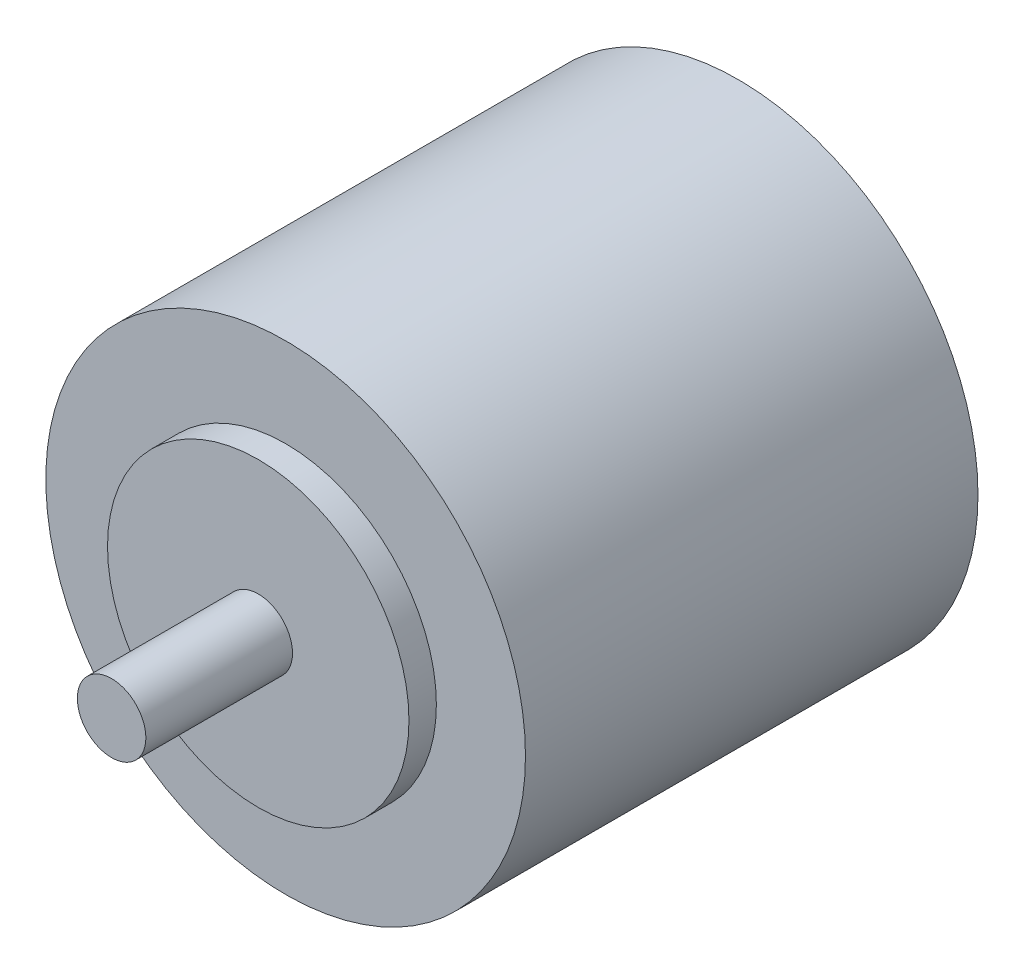
from build123d import *

# Parameters (mm, degrees)
SKETCH1_R           = 17.5
BOSS_EXTRUDE1_DEPTH = 33.02


with BuildPart() as part:
    # Sketch1 → Boss-Extrude1 (new body)
    with BuildSketch(Plane.XY.offset(33.02)):
        Circle(SKETCH1_R)
    extrude(amount=-BOSS_EXTRUDE1_DEPTH)

    # Sketch6 → Revolve5 (revolve)
    with BuildSketch(Plane(origin=(0, 0, 0), x_dir=(1, 0, 0), z_dir=(0, 1, 0))):
        Polygon((10.9982, -33.02), (0, -33.02), (0, -45.72), (2.5, -45.72), (2.5, -35.02), (10.9982, -35.02), align=None)
    revolve(axis=Axis((0, 0, 33.02), (0, 0, 1)))


solid = part.part
